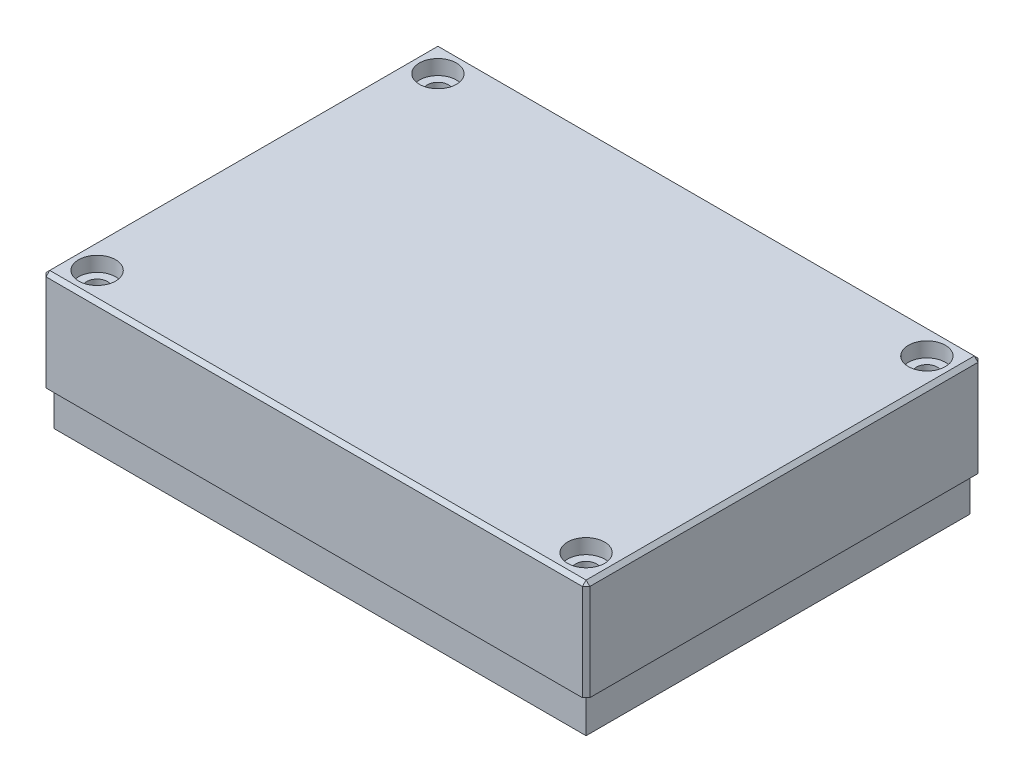
from build123d import *

# Parameters (mm, degrees)
SKETCH_1_W           = 73.4
SKETCH_1_H           = 53.4
SKETCH_1_W_2         = 69.6
SKETCH_1_H_2         = 49.6
EXTRUDE_1_DEPTH      = 17
SKETCH_2_W           = 73.4
SKETCH_2_H           = 53.4
EXTRUDE_2_DEPTH      = 1.5
SKETCH_3_W           = 4.5
SKETCH_3_H           = 4.5
EXTRUDE_3_DEPTH      = 17
SKETCH_9_R           = 3.252691193
EXTRUDE_5_DEPTH      = 2
CHAMFER_1_SIZE       = 0.5
SKETCH_6_OUTSIDE_W   = 93.928
SKETCH_6_OUTSIDE_H   = 73.928
SKETCH_6_OUTSIDE_W_2 = 71.8
SKETCH_6_OUTSIDE_H_2 = 51.8
CUT_EXTRUDE_3_DEPTH  = 5
SKETCH_5_R           = 1.4
CUT_EXTRUDE_2_DEPTH  = 50.010509077
CUT_EXTRUDE_4_REACH  = 68.988
SKETCH_7_W           = 10
SKETCH_7_H           = 6.4
SKETCH_8_R           = 2.5
CUT_EXTRUDE_5_DEPTH  = 2
SKETCH_10_W          = 9.5
SKETCH_10_H          = 6.5
CUT_EXTRUDE_6_DEPTH  = 0.8
CUT_EXTRUDE_7_REACH  = 81.2
SKETCH_11_W          = 8.2
SKETCH_11_H          = 4.5
FILLET_1_R           = 1


with BuildPart() as part:
    # Эскиз1 → Бобышка-Вытянуть1 (new body)
    with BuildSketch(Plane(origin=(0, 0, 0), x_dir=(1, 0, 0), z_dir=(0, 1, 0))):
        Rectangle(SKETCH_1_W, SKETCH_1_H)
        Rectangle(SKETCH_1_W_2, SKETCH_1_H_2, mode=Mode.SUBTRACT)
    extrude(amount=-EXTRUDE_1_DEPTH)

    # Эскиз2 → Бобышка-Вытянуть2 (add)
    with BuildSketch(Plane(origin=(0, 0, 0), x_dir=(1, 0, 0), z_dir=(0, 1, 0))):
        Rectangle(SKETCH_2_W, SKETCH_2_H)
    extrude(amount=EXTRUDE_2_DEPTH)

    # Эскиз3 → Бобышка-Вытянуть3 (add, through all)
    with BuildSketch(Plane(origin=(0, 0, 0), x_dir=(1, 0, 0), z_dir=(0, 1, 0))):
        with Locations((-32.55, 22.55)):
            Rectangle(SKETCH_3_W, SKETCH_3_H)
        with Locations((32.55, 22.55)):
            Rectangle(SKETCH_3_W, SKETCH_3_H)
        with Locations((-32.55, -22.55)):
            Rectangle(SKETCH_3_W, SKETCH_3_H)
        with Locations((32.55, -22.55)):
            Rectangle(SKETCH_3_W, SKETCH_3_H)
    extrude(amount=-EXTRUDE_3_DEPTH)

    # Эскиз9 → Бобышка-Вытянуть5 (add)
    with BuildSketch(Plane(origin=(0, 0, 0), x_dir=(-1, 0, 0), z_dir=(0, 1, 0))):
        with Locations((-33, 23)):
            Circle(SKETCH_9_R)
        with Locations((-33, -23)):
            Circle(SKETCH_9_R)
        with Locations((33, -23)):
            Circle(SKETCH_9_R)
        with Locations((33, 23)):
            Circle(SKETCH_9_R)
    extrude(amount=-EXTRUDE_5_DEPTH)

    # Фаска1
    chamfer_1_edges = [part.edges().sort_by_distance(p)[0] for p in [
        (-36.7, 1.5, 0),
        (0, 1.5, 26.7),
        (36.7, 1.5, 0),
        (0, 1.5, -26.7),
        (-36.7, -7.75, -26.7),
        (36.7, -7.75, -26.7),
        (36.7, -7.75, 26.7),
        (-36.7, -7.75, 26.7),
    ]]
    chamfer(chamfer_1_edges, length=CHAMFER_1_SIZE)

    # Эскиз6 outside → Вырез-Вытянуть3 (cut)
    with BuildSketch(Plane.XZ.offset(17)):
        Rectangle(SKETCH_6_OUTSIDE_W, SKETCH_6_OUTSIDE_H)
        Rectangle(SKETCH_6_OUTSIDE_W_2, SKETCH_6_OUTSIDE_H_2, mode=Mode.SUBTRACT)
    extrude(amount=-CUT_EXTRUDE_3_DEPTH, mode=Mode.SUBTRACT)

    # Эскиз5 → Вырез-Вытянуть2 (cut, through all)
    with BuildSketch(Plane.XZ.offset(17)):
        with Locations(Location((-33, 23, 0), (0, 0, 270))):
            Circle(SKETCH_5_R)
        with Locations(Location((33, 23, 0), (0, 0, 90))):
            Circle(SKETCH_5_R)
        with Locations(Location((33, -23, 0), (0, 0, 270))):
            Circle(SKETCH_5_R)
        with Locations(Location((-33, -23, 0), (0, 0, 90))):
            Circle(SKETCH_5_R)
    extrude(amount=-CUT_EXTRUDE_2_DEPTH, mode=Mode.SUBTRACT)

    # Эскиз7 → Вырез-Вытянуть4 (cut, up to next)
    with BuildSketch(Plane(origin=(0, 0, -26.7), x_dir=(-1, 0, 0), z_dir=(0, 0, -1)), mode=Mode.PRIVATE) as cut_extrude_4_sk1:
        with Locations((-19, -15.2)):
            Rectangle(SKETCH_7_W, SKETCH_7_H)
    cut_extrude_4_tool1 = extrude(cut_extrude_4_sk1.sketch, amount=-CUT_EXTRUDE_4_REACH, mode=Mode.PRIVATE) & part.part
    # Эскиз7 → Вырез-Вытянуть4 (cut, up to next)
    with BuildSketch(Plane(origin=(0, 0, -26.7), x_dir=(-1, 0, 0), z_dir=(0, 0, -1)), mode=Mode.PRIVATE) as cut_extrude_4_sk2:
        with Locations((11.5, -15.2)):
            Rectangle(SKETCH_7_W, SKETCH_7_H)
    cut_extrude_4_tool2 = extrude(cut_extrude_4_sk2.sketch, amount=-CUT_EXTRUDE_4_REACH, mode=Mode.PRIVATE) & part.part
    add(cut_extrude_4_tool1.solids().sort_by_distance((19, -15.2, -26.7))[0], mode=Mode.SUBTRACT)
    add(cut_extrude_4_tool2.solids().sort_by_distance((-11.5, -15.2, -26.7))[0], mode=Mode.SUBTRACT)

    # Эскиз8 → Вырез-Вытянуть5 (cut)
    with BuildSketch(Plane(origin=(0, 1.5, 0), x_dir=(1, 0, 0), z_dir=(0, 1, 0))):
        with Locations(Location((-33, 23, 0), (0, 0, 270))):
            Circle(SKETCH_8_R)
        with Locations(Location((33, 23, 0), (0, 0, 270))):
            Circle(SKETCH_8_R)
        with Locations(Location((33, -23, 0), (0, 0, 270))):
            Circle(SKETCH_8_R)
        with Locations(Location((-33, -23, 0), (0, 0, 270))):
            Circle(SKETCH_8_R)
    extrude(amount=-CUT_EXTRUDE_5_DEPTH, mode=Mode.SUBTRACT)

    # Эскиз10 → Вырез-Вытянуть6 (cut)
    with BuildSketch(Plane.ZY.offset(36.7)):
        with Locations((11.7, -3.25)):
            Rectangle(SKETCH_10_W, SKETCH_10_H)
    extrude(amount=-CUT_EXTRUDE_6_DEPTH, mode=Mode.SUBTRACT)

    # Эскиз11 → Вырез-Вытянуть7 (cut, up to next)
    with BuildSketch(Plane.ZY.offset(35.9), mode=Mode.PRIVATE) as cut_extrude_7_sk1:
        with Locations((11.7, -3.25)):
            Rectangle(SKETCH_11_W, SKETCH_11_H)
    cut_extrude_7_tool1 = extrude(cut_extrude_7_sk1.sketch, amount=-CUT_EXTRUDE_7_REACH, mode=Mode.PRIVATE) & part.part
    add(cut_extrude_7_tool1.solids().sort_by_distance((-35.9, -3.25, 11.7))[0], mode=Mode.SUBTRACT)

    # Скругление1
    # the kernel refuses this fillet: 1 mm, written as the material it adds along each edge
    with BuildSketch(Plane(origin=(-33, 0, -23), x_dir=(-0.9768477562841145, 0, 0.21393564696583717), z_dir=(-0.21393564696583717, 0, -0.9768477562841145))) as fillet_1_piece_1_section:
        with BuildLine():
            CenterArc((3.252691193 + FILLET_1_R, -FILLET_1_R), FILLET_1_R, 90, 90)
            Line((3.252691193, -FILLET_1_R), (3.252691193, 0))
            Line((3.252691193, 0), (3.252691193 + FILLET_1_R, 0))
        make_face()
    fillet_1_piece_1 = revolve(axis=Axis((-33, 0, -23), (0, 1, 0)), revolution_arc=155.58691753, mode=Mode.PRIVATE)
    fillet_1_piece_1 = split(fillet_1_piece_1, bisect_by=Plane(origin=(-34.8, -0.215043292, -19.734246257), z_dir=(1, 0, 0)), keep=Keep.TOP, mode=Mode.PRIVATE)
    add(fillet_1_piece_1)
    with BuildSketch(Plane(origin=(-33, 0, -23), x_dir=(0.20893573542178995, 0, 0.9779293729425228), z_dir=(-0.9779293729425228, 0, 0.20893573542178995))) as fillet_1_piece_2_section:
        with BuildLine():
            CenterArc((3.252691193 + FILLET_1_R, -FILLET_1_R), FILLET_1_R, 90, 90)
            Line((3.252691193, -FILLET_1_R), (3.252691193, 0))
            Line((3.252691193, 0), (3.252691193 + FILLET_1_R, 0))
        make_face()
    fillet_1_piece_2 = revolve(axis=Axis((-33, 0, -23), (0, 1, 0)), revolution_arc=155.58691753, mode=Mode.PRIVATE)
    fillet_1_piece_2 = split(fillet_1_piece_2, bisect_by=Plane(origin=(-31.496865792, -0.203453463, -24.8), z_dir=(0, 0, 1)), keep=Keep.TOP, mode=Mode.PRIVATE)
    add(fillet_1_piece_2)
    with BuildSketch(Plane(origin=(-33, 0, 23), x_dir=(0.21393564696585013, 0, 0.9768477562841116), z_dir=(-0.9768477562841116, 0, 0.21393564696585013))) as fillet_1_piece_3_section:
        with BuildLine():
            CenterArc((3.252691193 + FILLET_1_R, -FILLET_1_R), FILLET_1_R, 90, 90)
            Line((3.252691193, -FILLET_1_R), (3.252691193, 0))
            Line((3.252691193, 0), (3.252691193 + FILLET_1_R, 0))
        make_face()
    fillet_1_piece_3 = revolve(axis=Axis((-33, 0, 23), (0, 1, 0)), revolution_arc=155.58691753, mode=Mode.PRIVATE)
    fillet_1_piece_3 = split(fillet_1_piece_3, bisect_by=Plane(origin=(-29.734246201, -0.215043247, 24.8), z_dir=(0, 0, -1)), keep=Keep.TOP, mode=Mode.PRIVATE)
    add(fillet_1_piece_3)
    with BuildSketch(Plane(origin=(-33, 0, 23), x_dir=(0.9779293729425067, 0, -0.20893573542186514), z_dir=(0.20893573542186514, 0, 0.9779293729425067))) as fillet_1_piece_4_section:
        with BuildLine():
            CenterArc((3.252691193 + FILLET_1_R, -FILLET_1_R), FILLET_1_R, 90, 90)
            Line((3.252691193, -FILLET_1_R), (3.252691193, 0))
            Line((3.252691193, 0), (3.252691193 + FILLET_1_R, 0))
        make_face()
    fillet_1_piece_4 = revolve(axis=Axis((-33, 0, 23), (0, 1, 0)), revolution_arc=155.58691753, mode=Mode.PRIVATE)
    fillet_1_piece_4 = split(fillet_1_piece_4, bisect_by=Plane(origin=(-34.8, -0.203453257, 21.496866097), z_dir=(1, 0, 0)), keep=Keep.TOP, mode=Mode.PRIVATE)
    add(fillet_1_piece_4)
    with BuildSketch(Plane(origin=(33, 0, 23), x_dir=(0.9768477562841055, 0, -0.21393564696587863), z_dir=(0.21393564696587863, 0, 0.9768477562841055))) as fillet_1_piece_5_section:
        with BuildLine():
            CenterArc((3.252691193 + FILLET_1_R, -FILLET_1_R), FILLET_1_R, 90, 90)
            Line((3.252691193, -FILLET_1_R), (3.252691193, 0))
            Line((3.252691193, 0), (3.252691193 + FILLET_1_R, 0))
        make_face()
    fillet_1_piece_5 = revolve(axis=Axis((33, 0, 23), (0, 1, 0)), revolution_arc=155.58691753, mode=Mode.PRIVATE)
    fillet_1_piece_5 = split(fillet_1_piece_5, bisect_by=Plane(origin=(34.8, -0.215043292, 19.734246257), z_dir=(-1, 0, 0)), keep=Keep.TOP, mode=Mode.PRIVATE)
    add(fillet_1_piece_5)
    with BuildSketch(Plane(origin=(33, 0, 23), x_dir=(-0.20893573542180963, 0, -0.9779293729425186), z_dir=(0.9779293729425186, 0, -0.20893573542180963))) as fillet_1_piece_6_section:
        with BuildLine():
            CenterArc((3.252691193 + FILLET_1_R, -FILLET_1_R), FILLET_1_R, 90, 90)
            Line((3.252691193, -FILLET_1_R), (3.252691193, 0))
            Line((3.252691193, 0), (3.252691193 + FILLET_1_R, 0))
        make_face()
    fillet_1_piece_6 = revolve(axis=Axis((33, 0, 23), (0, 1, 0)), revolution_arc=155.58691753, mode=Mode.PRIVATE)
    fillet_1_piece_6 = split(fillet_1_piece_6, bisect_by=Plane(origin=(31.496865792, -0.203453463, 24.8), z_dir=(0, 0, -1)), keep=Keep.TOP, mode=Mode.PRIVATE)
    add(fillet_1_piece_6)
    with BuildSketch(Plane(origin=(33, 0, -23), x_dir=(-0.2139356469658719, 0, -0.9768477562841068), z_dir=(0.9768477562841068, 0, -0.2139356469658719))) as fillet_1_piece_7_section:
        with BuildLine():
            CenterArc((3.252691193 + FILLET_1_R, -FILLET_1_R), FILLET_1_R, 90, 90)
            Line((3.252691193, -FILLET_1_R), (3.252691193, 0))
            Line((3.252691193, 0), (3.252691193 + FILLET_1_R, 0))
        make_face()
    fillet_1_piece_7 = revolve(axis=Axis((33, 0, -23), (0, 1, 0)), revolution_arc=155.58691753, mode=Mode.PRIVATE)
    fillet_1_piece_7 = split(fillet_1_piece_7, bisect_by=Plane(origin=(29.734246201, -0.215043247, -24.8), z_dir=(0, 0, 1)), keep=Keep.TOP, mode=Mode.PRIVATE)
    add(fillet_1_piece_7)
    with BuildSketch(Plane(origin=(33, 0, -23), x_dir=(-0.9779293729425086, 0, 0.20893573542185656), z_dir=(-0.20893573542185656, 0, -0.9779293729425086))) as fillet_1_piece_8_section:
        with BuildLine():
            CenterArc((3.252691193 + FILLET_1_R, -FILLET_1_R), FILLET_1_R, 90, 90)
            Line((3.252691193, -FILLET_1_R), (3.252691193, 0))
            Line((3.252691193, 0), (3.252691193 + FILLET_1_R, 0))
        make_face()
    fillet_1_piece_8 = revolve(axis=Axis((33, 0, -23), (0, 1, 0)), revolution_arc=155.58691753, mode=Mode.PRIVATE)
    fillet_1_piece_8 = split(fillet_1_piece_8, bisect_by=Plane(origin=(34.8, -0.203453257, -21.496866097), z_dir=(-1, 0, 0)), keep=Keep.TOP, mode=Mode.PRIVATE)
    add(fillet_1_piece_8)


solid = part.part
